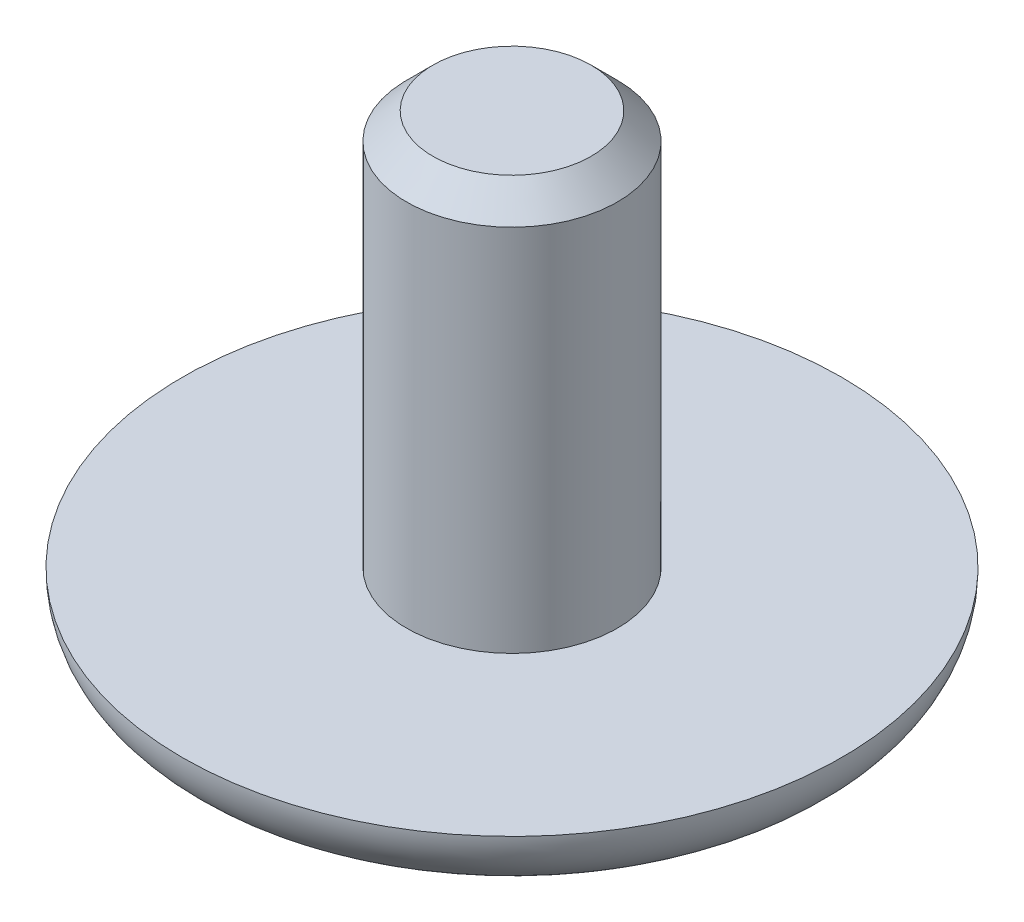
from build123d import *

# Parameters (mm, degrees)
CHAMFER_1_SIZE                = 0.2
FILLET_1_R                    = 0.5
SKETCH_2_W                    = 0.8
SKETCH_2_H                    = 3.5
CUT_EXTRUDE_1_DEPTH           = 0.3
CUT_EXTRUDE_1_DRAFT           = -25
SKETCH_2_W_2                  = 3.5
SKETCH_2_H_2                  = 0.8
CUT_EXTRUDE_1_PROFILE_2_DEPTH = 0.3
CUT_EXTRUDE_1_PROFILE_2_DRAFT = -25


with BuildPart() as part:
    # 草图1 → 旋转1 (revolve)
    with BuildSketch(Plane.XY, mode=Mode.PRIVATE) as revolve_1_sk:
        Polygon((0, 0), (-2.5, 0), (-2.5, 0.5), (-0.8, 0.5), (-0.8, 3.5), (0, 3.5), align=None)
    revolve(revolve_1_sk.sketch.rotate(Axis((0, 0, 0), (0, 1, 0)), 270), axis=Axis((0, 0, 0), (0, 1, 0)))

    # 倒角1
    chamfer_1_edges = [part.edges().sort_by_distance(p)[0] for p in [
        (0, 3.5, 0.8),
    ]]
    chamfer(chamfer_1_edges, length=CHAMFER_1_SIZE)

    # 圆角1
    fillet_1_edges = [part.edges().sort_by_distance(p)[0] for p in [
        (0, 0, 2.5),
    ]]
    fillet(fillet_1_edges, radius=FILLET_1_R - 0.0001)  # a hair under: the kernel refuses the full size


with BuildPart() as cut_extrude_1_tool:
    # 草图2 → 切除-拉伸1 (with draft: the straight prism first)
    with BuildSketch(Plane.XZ):
        Rectangle(SKETCH_2_W, SKETCH_2_H)
    extrude(amount=-CUT_EXTRUDE_1_DEPTH)
    # 切除-拉伸1: the draft: its side faces are tilted about the plane it starts from
    cut_extrude_1_sides = [cut_extrude_1_tool.faces().sort_by_distance(p)[0] for p in [
        (-0.4, 0.15, 0),
        (0, 0.15, -1.75),
        (0.4, 0.15, 0),
        (0, 0.15, 1.75),
    ]]
    draft(cut_extrude_1_sides, Plane.XZ, CUT_EXTRUDE_1_DRAFT)


with BuildPart() as part_1:
    add(part.part)

    # 切除-拉伸1: cut by cut_extrude_1_tool
    add(cut_extrude_1_tool.part, mode=Mode.SUBTRACT)


with BuildPart() as cut_extrude_1_profile_2_tool:
    # 草图2 → 切除-拉伸1 profile 2 (with draft: the straight prism first)
    with BuildSketch(Plane.XZ):
        Rectangle(SKETCH_2_W_2, SKETCH_2_H_2)
    extrude(amount=-CUT_EXTRUDE_1_PROFILE_2_DEPTH)
    # 切除-拉伸1 profile 2: the draft: its side faces are tilted about the plane it starts from
    cut_extrude_1_profile_2_sides = [cut_extrude_1_profile_2_tool.faces().sort_by_distance(p)[0] for p in [
        (-1.75, 0.15, 0),
        (0, 0.15, -0.4),
        (1.75, 0.15, 0),
        (0, 0.15, 0.4),
    ]]
    draft(cut_extrude_1_profile_2_sides, Plane.XZ, CUT_EXTRUDE_1_PROFILE_2_DRAFT)


with BuildPart() as part_2:
    add(part_1.part)

    # 切除-拉伸1 profile 2: cut by cut_extrude_1_profile_2_tool
    add(cut_extrude_1_profile_2_tool.part, mode=Mode.SUBTRACT)


solid = part_2.part
